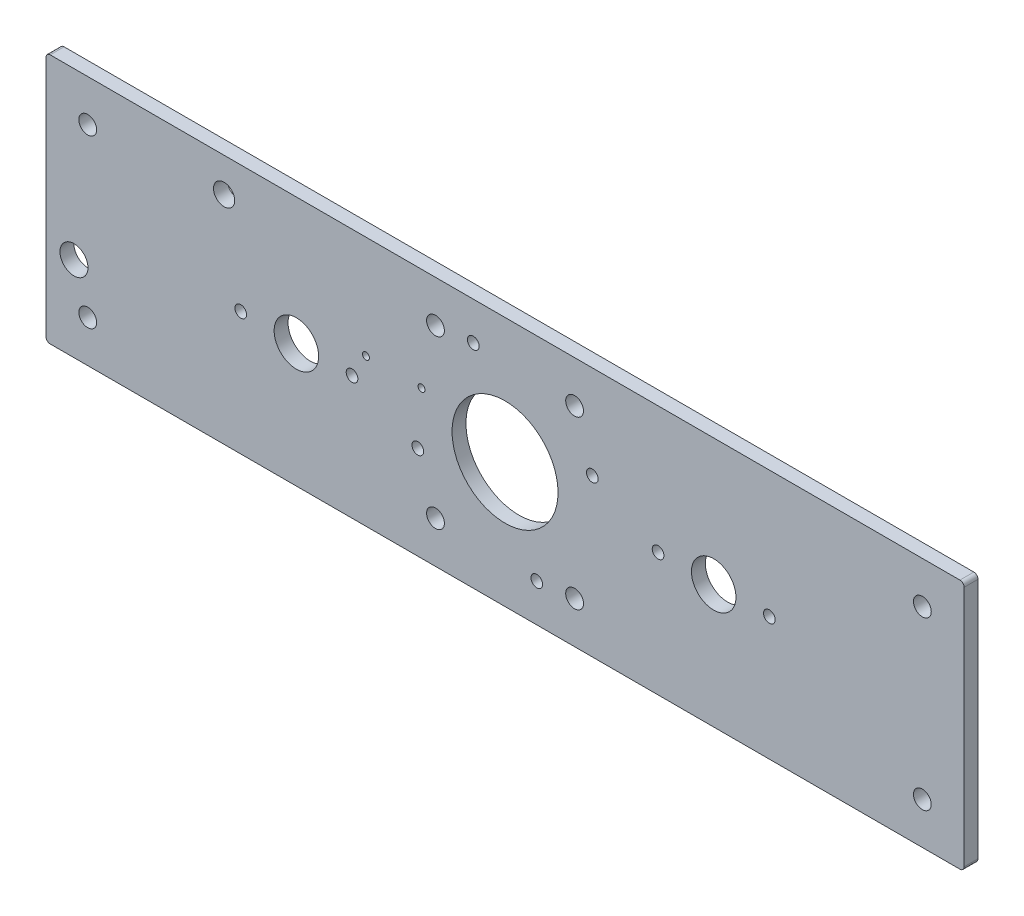
from build123d import *

# Parameters (mm, degrees)
SKETCH1_W             = 330
SKETCH1_H             = 90
SKETCH1_R             = 19.05
BOSS_EXTRUDE1_DEPTH   = 2.5
M6_CLEARANCE_HOLE1_D  = 6.4
SKETCH3_R             = 8
CUT_EXTRUDE2_DEPTH    = 172.099386323
M5X0_8_TAPPED_HOLE1_D = 4.2
M5X0_8_TAPPED_HOLE3_D = 4.2
FILLET1_R             = 1.5
M3X0_5_TAPPED_HOLE1_D = 2.5
SKETCH13_R            = 3.812820203
CUT_EXTRUDE3_DEPTH    = 172.099386323
SKETCH14_R            = 5.027775544
CUT_EXTRUDE4_DEPTH    = 10


with BuildPart() as part:
    # Sketch1 → Boss-Extrude1 (new, symmetric)
    with BuildSketch(Plane.XY):
        Rectangle(SKETCH1_W, SKETCH1_H)
        Circle(SKETCH1_R, mode=Mode.SUBTRACT)
    extrude(amount=BOSS_EXTRUDE1_DEPTH, both=True)

    # M6 Clearance Hole1 (through all)
    with Locations(Plane.XY.offset(2.5)):
        with Locations((-150, 30), (-25, 30), (-25, -30), (-150, -30)):
            m6_clearance_hole1 = Hole(M6_CLEARANCE_HOLE1_D / 2)

    # Mirror2: M6 Clearance Hole1 across plane
    add(m6_clearance_hole1.mirror(Plane(origin=(0, 0, 0), x_dir=(0, 0, 1), z_dir=(1, 0, 0))), mode=Mode.SUBTRACT)

    # Sketch3 → Cut-Extrude2 (cut, through all)
    with BuildSketch(Plane.XY.offset(2.5)):
        with Locations((-75, -0.6)):
            Circle(SKETCH3_R)
    cut_extrude2 = extrude(amount=-CUT_EXTRUDE2_DEPTH, mode=Mode.SUBTRACT)

    # M5x0.8 Tapped Hole1 (through all)
    with Locations(Plane.XY.offset(2.5)):
        with Locations((-95, -0.6), (-55, -0.6)):
            m5x0_8_tapped_hole1 = Hole(M5X0_8_TAPPED_HOLE1_D / 2)

    # Mirror1: Cut-Extrude2, M5x0.8 Tapped Hole1 across plane
    add(cut_extrude2.mirror(Plane(origin=(0, 0, 0), x_dir=(0, 0, 1), z_dir=(1, 0, 0))), mode=Mode.SUBTRACT)
    add(m5x0_8_tapped_hole1.mirror(Plane(origin=(0, 0, 0), x_dir=(0, 0, 1), z_dir=(1, 0, 0))), mode=Mode.SUBTRACT)

    # M5x0.8 Tapped Hole3 (through all)
    with Locations(Plane.XY.offset(2.5)):
        with Locations((-11.415072797, 31.362654751), (11.415072797, -31.362654751), (-31.362654751, -11.415072797), (31.362654751, 11.415072797)):
            Hole(M5X0_8_TAPPED_HOLE3_D / 2)

    # Fillet1
    fillet1_edges = [part.edges().sort_by_distance(p)[0] for p in [
        (-165, -45, 0),
        (165, -45, 0),
        (165, 45, 0),
        (-165, 45, 0),
    ]]
    fillet(fillet1_edges, radius=FILLET1_R)

    # M3x0.5 Tapped Hole1 (through all)
    with Locations(Plane.XY.offset(2.5)):
        with Locations((-50, 8), (-30, 8)):
            Hole(M3X0_5_TAPPED_HOLE1_D / 2)

    # Sketch13 → Cut-Extrude3 (cut, through all)
    with BuildSketch(Plane.XY.offset(2.5)):
        with Locations((-100.98991849, 32.782067782)):
            Circle(SKETCH13_R)
    extrude(amount=-CUT_EXTRUDE3_DEPTH, mode=Mode.SUBTRACT)

    # Sketch14 → Cut-Extrude4 (cut)
    with BuildSketch(Plane.XY.offset(2.5)):
        with Locations((-154.944784256, -14.507326579)):
            Circle(SKETCH14_R)
    extrude(amount=-CUT_EXTRUDE4_DEPTH, mode=Mode.SUBTRACT)


solid = part.part
